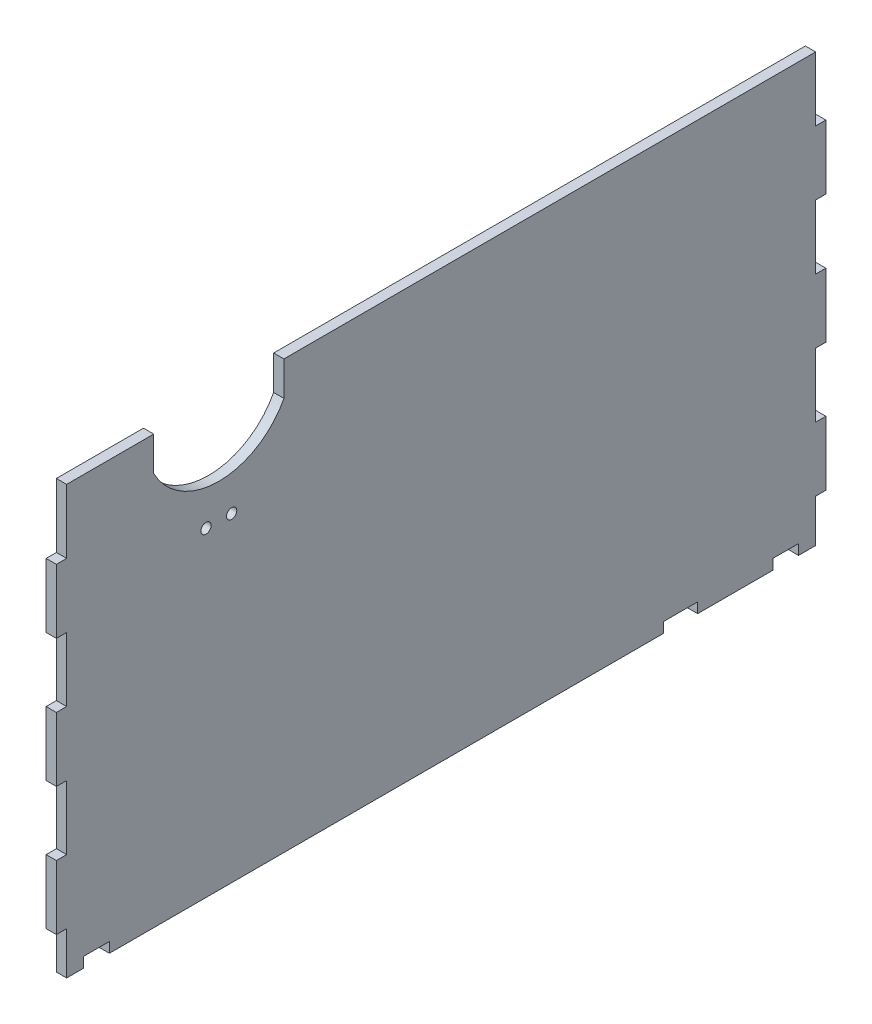
from build123d import *

# Parameters (mm, degrees)
SKETCH1_W            = 450
SKETCH1_H            = 250
BOSS_EXTRUDE1_DEPTH  = 6
SKETCH2_W            = 6
SKETCH2_H            = 37.5
CUT_EXTRUDE1_DEPTH   = 515.816472153
LPATTERN1_COUNT      = 4
LPATTERN1_PITCH      = 75
LPATTERN1_COUNT_DIR2 = 2
LPATTERN1_PITCH_DIR2 = 444
SKETCH3_W            = 15
SKETCH3_H            = 6
CUT_EXTRUDE2_DEPTH   = 515.816472153
LPATTERN2_COUNT      = 2
LPATTERN2_PITCH      = 403
SKETCH4_R            = 3
CUT_EXTRUDE3_DEPTH   = 10
SKETCH5_W            = 20
SKETCH5_H            = 6
CUT_EXTRUDE4_DEPTH   = 515.816472153


with BuildPart() as part:
    # Sketch1 → Boss-Extrude1 (new body)
    with BuildSketch(Plane(origin=(0, 0, 0), x_dir=(0, 0, -1), z_dir=(1, 0, 0))):
        with Locations((-225, 125)):
            Rectangle(SKETCH1_W, SKETCH1_H)
    extrude(amount=BOSS_EXTRUDE1_DEPTH)

    # Sketch2 → Cut-Extrude1 (cut, through all)
    with BuildSketch(Plane(origin=(6, 0, 0), x_dir=(0, 0, -1), z_dir=(1, 0, 0))):
        with Locations((-447, 231.25)):
            Rectangle(SKETCH2_W, SKETCH2_H)
    cut_extrude1 = extrude(amount=-CUT_EXTRUDE1_DEPTH, mode=Mode.SUBTRACT)

    # LPattern1: Cut-Extrude1 4 × 2
    with Locations(*[(0, -i * LPATTERN1_PITCH, -j * LPATTERN1_PITCH_DIR2) for i in range(LPATTERN1_COUNT) for j in range(LPATTERN1_COUNT_DIR2) if (i, j) != (0, 0)]):
        add(cut_extrude1, mode=Mode.SUBTRACT)

    # Sketch3 → Cut-Extrude2 (cut, through all)
    with BuildSketch(Plane(origin=(6, 0, 0), x_dir=(0, 0, -1), z_dir=(1, 0, 0))):
        with Locations((-426.5, 3)):
            Rectangle(SKETCH3_W, SKETCH3_H)
    cut_extrude2 = extrude(amount=-CUT_EXTRUDE2_DEPTH, mode=Mode.SUBTRACT)

    # LPattern2: Cut-Extrude2 ×2
    with Locations(*[(0, 0, -i * LPATTERN2_PITCH) for i in range(1, LPATTERN2_COUNT)]):
        add(cut_extrude2, mode=Mode.SUBTRACT)

    # Sketch4 → Cut-Extrude3 (cut)
    with BuildSketch(Plane(origin=(6, 0, 0), x_dir=(0, 0, -1), z_dir=(1, 0, 0))):
        with Locations((-362.5, 187)):
            Circle(SKETCH4_R)
        with Locations((-347.5, 187)):
            Circle(SKETCH4_R)
        with BuildLine():
            Line((-393.065732621, 230), (-393.065732621, 250))
            Line((-393.065732621, 250), (-316.934267379, 250))
            Line((-316.934267379, 250), (-316.934267379, 230))
            ThreePointArc((-316.934267379, 230), (-355, 207), (-393.065732621, 230))
        make_face()
    extrude(amount=-CUT_EXTRUDE3_DEPTH, mode=Mode.SUBTRACT)

    # Sketch5 → Cut-Extrude4 (cut, through all)
    with BuildSketch(Plane(origin=(6, 0, 0), x_dir=(0, 0, -1), z_dir=(1, 0, 0))):
        with Locations((-85, 3)):
            Rectangle(SKETCH5_W, SKETCH5_H)
    extrude(amount=-CUT_EXTRUDE4_DEPTH, mode=Mode.SUBTRACT)


solid = part.part
